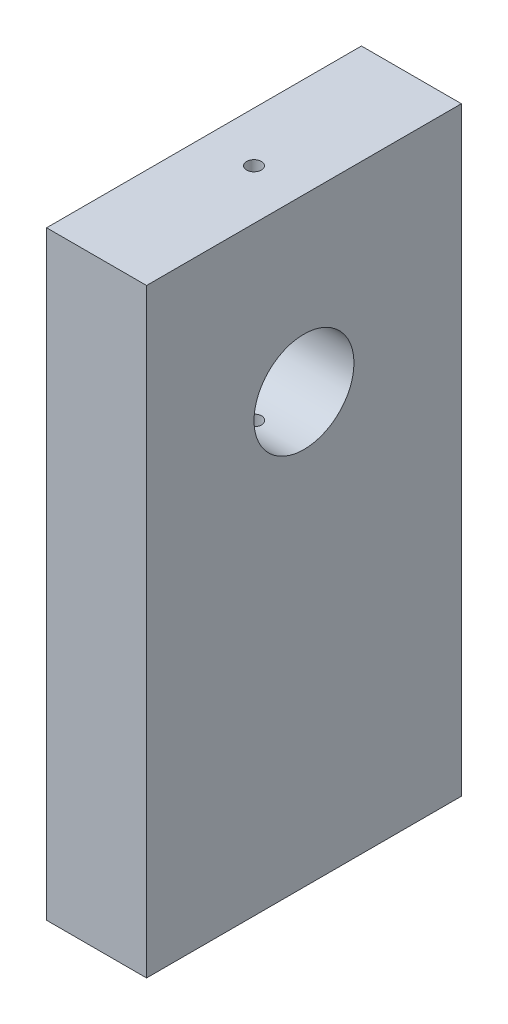
from build123d import *

# Parameters (mm, degrees)
SKETCH11_W          = 12.7
SKETCH11_H          = 40
BOSS_EXTRUDE2_DEPTH = 76.2
SKETCH12_R          = 6.35
CUT_EXTRUDE5_DEPTH  = 83.179527863
SKETCH13_R          = 0.95
CUT_EXTRUDE6_DEPTH  = 30
SKETCH17_R          = 0.95
CUT_EXTRUDE8_DEPTH  = 21


with BuildPart() as part:
    # Sketch11 → Boss-Extrude2 (new body)
    with BuildSketch(Plane(origin=(0, 0, 0), x_dir=(1, 0, 0), z_dir=(0, 1, 0))):
        with Locations((6.35, -8.031139822)):
            Rectangle(SKETCH11_W, SKETCH11_H)
    extrude(amount=BOSS_EXTRUDE2_DEPTH)

    # Sketch12 → Cut-Extrude5 (cut, through all)
    with BuildSketch(Plane(origin=(12.7, 0, 0), x_dir=(0, 0, -1), z_dir=(1, 0, 0))):
        with Locations((-8.031139822, 54.5)):
            Circle(SKETCH12_R)
    extrude(amount=-CUT_EXTRUDE5_DEPTH, mode=Mode.SUBTRACT)

    # Sketch13 → Cut-Extrude6 (cut)
    with BuildSketch(Plane(origin=(0, 76.2, 0), x_dir=(1, 0, 0), z_dir=(0, 1, 0))):
        with Locations((6.35, -8.031139822)):
            Circle(SKETCH13_R)
    extrude(amount=-CUT_EXTRUDE6_DEPTH, mode=Mode.SUBTRACT)

    # Sketch17 → Cut-Extrude8 (cut)
    with BuildSketch(Plane.XZ):
        with Locations((6.35, 14.698139822)):
            Circle(SKETCH17_R)
        with Locations((6.35, 1.364139822)):
            Circle(SKETCH17_R)
    extrude(amount=-CUT_EXTRUDE8_DEPTH, mode=Mode.SUBTRACT)


solid = part.part
